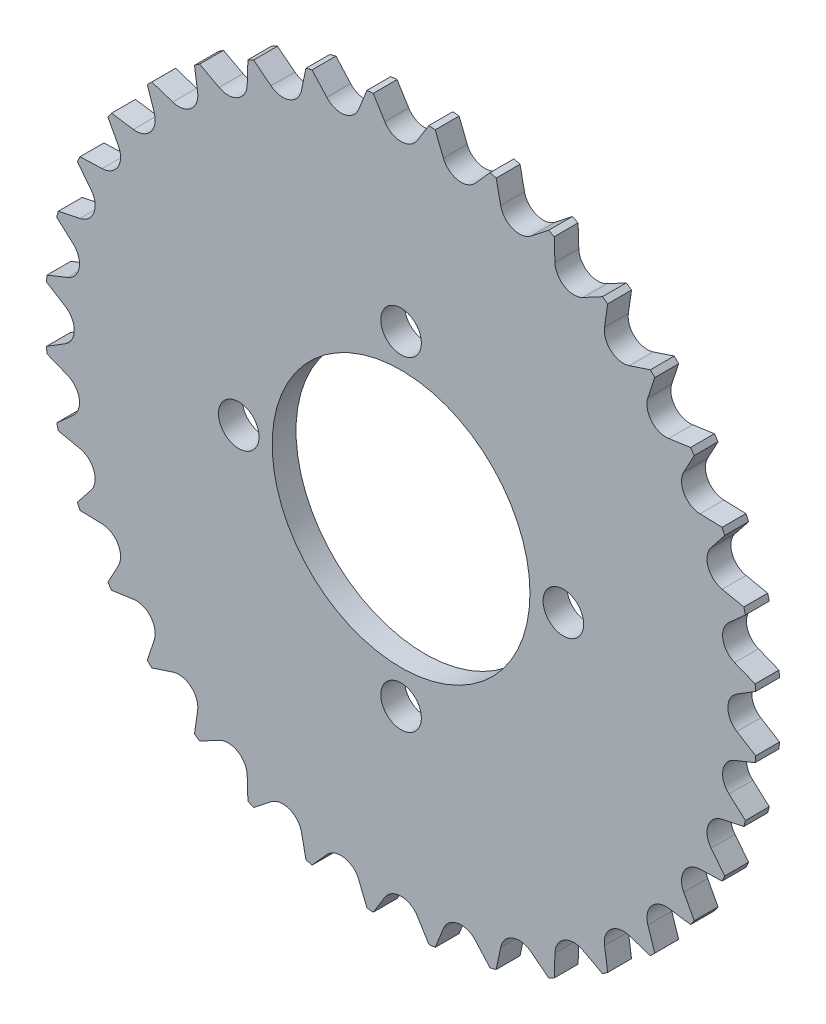
from build123d import *

# Parameters (mm, degrees)
BOSS_EXTRUDE1_DEPTH = 5
SKETCH9_R           = 100
SKETCH9_R_2         = 74.5
CUT_EXTRUDE5_DEPTH  = 10
SKETCH10_R          = 27
SKETCH10_R_2        = 4.25
CUT_EXTRUDE6_DEPTH  = 106.154425696


with BuildPart() as part:
    # Sketch1 → Boss-Extrude1 (new body)
    with BuildSketch(Plane.XY):
        with BuildLine():
            ThreePointArc((3.400646872, 70.34391338), (0, 68.45), (-3.400646872, 70.34391338))
            Line((-3.400646872, 70.34391338), (-6.085453124, 74.679004775))
            ThreePointArc((-6.085453124, 74.679004775), (-6.554111855, 74.913841296), (-6.974871672, 74.601190735))
            Line((-6.974871672, 74.601190735), (-8.866108963, 69.865747406))
            ThreePointArc((-8.866108963, 69.865747406), (-11.886217761, 67.410090694), (-15.564075773, 68.684715142))
            Line((-15.564075773, 68.684715142), (-18.960874506, 72.487735044))
            ThreePointArc((-18.960874506, 72.487735044), (-19.463192192, 72.637622137), (-19.823268522, 72.256657264))
            Line((-19.823268522, 72.256657264), (-20.863472565, 67.264746051))
            ThreePointArc((-20.863472565, 67.264746051), (-23.411278811, 64.321959893), (-27.254598108, 64.93856659))
            Line((-27.254598108, 64.93856659), (-31.260179312, 68.093962165))
            ThreePointArc((-31.260179312, 68.093962165), (-31.780893283, 68.154345585), (-32.069345388, 67.716641827))
            Line((-32.069345388, 67.716641827), (-32.226910109, 62.619939425))
            ThreePointArc((-32.226910109, 62.619939425), (-34.225, 59.279438889), (-38.117003271, 59.219292553))
            Line((-38.117003271, 59.219292553), (-42.609659387, 61.631188702))
            ThreePointArc((-42.609659387, 61.631188702), (-43.132948014, 61.600233731), (-43.341011423, 61.119090493))
            Line((-43.341011423, 61.119090493), (-42.611149298, 56.072457626))
            ThreePointArc((-42.611149298, 56.072457626), (-43.998811883, 52.435742131), (-47.821242577, 51.700670278))
            Line((-47.821242577, 51.700670278), (-52.664466523, 53.295782758))
            ThreePointArc((-52.664466523, 53.295782758), (-53.174429945, 53.174429945), (-53.295782758, 52.664466523))
            Line((-53.295782758, 52.664466523), (-51.700670278, 47.821242577))
            ThreePointArc((-51.700670278, 47.821242577), (-52.435742131, 43.998811883), (-56.072457626, 42.611149298))
            Line((-56.072457626, 42.611149298), (-61.119090493, 43.341011423))
            ThreePointArc((-61.119090493, 43.341011423), (-61.600233731, 43.132948014), (-61.631188702, 42.609659387))
            Line((-61.631188702, 42.609659387), (-59.219292553, 38.117003271))
            ThreePointArc((-59.219292553, 38.117003271), (-59.279438889, 34.225), (-62.619939425, 32.226910109))
            Line((-62.619939425, 32.226910109), (-67.716641827, 32.069345388))
            ThreePointArc((-67.716641827, 32.069345388), (-68.154345585, 31.780893283), (-68.093962165, 31.260179312))
            Line((-68.093962165, 31.260179312), (-64.93856659, 27.254598108))
            ThreePointArc((-64.93856659, 27.254598108), (-64.321959893, 23.411278811), (-67.264746051, 20.863472565))
            Line((-67.264746051, 20.863472565), (-72.256657264, 19.823268522))
            ThreePointArc((-72.256657264, 19.823268522), (-72.637622137, 19.463192192), (-72.487735044, 18.960874506))
            Line((-72.487735044, 18.960874506), (-68.684715142, 15.564075773))
            ThreePointArc((-68.684715142, 15.564075773), (-67.410090694, 11.886217761), (-69.865747406, 8.866108963))
            Line((-69.865747406, 8.866108963), (-74.601190735, 6.974871672))
            ThreePointArc((-74.601190735, 6.974871672), (-74.913841296, 6.554111855), (-74.679004775, 6.085453124))
            Line((-74.679004775, 6.085453124), (-70.34391338, 3.400646872))
            ThreePointArc((-70.34391338, 3.400646872), (-68.45, 0), (-70.34391338, -3.400646872))
            Line((-70.34391338, -3.400646872), (-74.679004775, -6.085453124))
            ThreePointArc((-74.679004775, -6.085453124), (-74.913841296, -6.554111855), (-74.601190735, -6.974871672))
            Line((-74.601190735, -6.974871672), (-69.865747406, -8.866108963))
            ThreePointArc((-69.865747406, -8.866108963), (-67.410090694, -11.886217761), (-68.684715142, -15.564075773))
            Line((-68.684715142, -15.564075773), (-72.487735044, -18.960874506))
            ThreePointArc((-72.487735044, -18.960874506), (-72.637622137, -19.463192192), (-72.256657264, -19.823268522))
            Line((-72.256657264, -19.823268522), (-67.264746051, -20.863472565))
            ThreePointArc((-67.264746051, -20.863472565), (-64.321959893, -23.411278811), (-64.93856659, -27.254598108))
            Line((-64.93856659, -27.254598108), (-68.093962165, -31.260179312))
            ThreePointArc((-68.093962165, -31.260179312), (-68.154345585, -31.780893283), (-67.716641827, -32.069345388))
            Line((-67.716641827, -32.069345388), (-62.619939425, -32.226910109))
            ThreePointArc((-62.619939425, -32.226910109), (-59.279438889, -34.225), (-59.219292553, -38.117003271))
            Line((-59.219292553, -38.117003271), (-61.631188702, -42.609659387))
            ThreePointArc((-61.631188702, -42.609659387), (-61.600233731, -43.132948014), (-61.119090493, -43.341011423))
            Line((-61.119090493, -43.341011423), (-56.072457626, -42.611149298))
            ThreePointArc((-56.072457626, -42.611149298), (-52.435742131, -43.998811883), (-51.700670278, -47.821242577))
            Line((-51.700670278, -47.821242577), (-53.295782758, -52.664466523))
            ThreePointArc((-53.295782758, -52.664466523), (-53.174429945, -53.174429945), (-52.664466523, -53.295782758))
            Line((-52.664466523, -53.295782758), (-47.821242577, -51.700670278))
            ThreePointArc((-47.821242577, -51.700670278), (-43.998811883, -52.435742131), (-42.611149298, -56.072457626))
            Line((-42.611149298, -56.072457626), (-43.341011423, -61.119090493))
            ThreePointArc((-43.341011423, -61.119090493), (-43.132948014, -61.600233731), (-42.609659387, -61.631188702))
            Line((-42.609659387, -61.631188702), (-38.117003271, -59.219292553))
            ThreePointArc((-38.117003271, -59.219292553), (-34.225, -59.279438889), (-32.226910109, -62.619939425))
            Line((-32.226910109, -62.619939425), (-32.069345388, -67.716641827))
            ThreePointArc((-32.069345388, -67.716641827), (-31.780893283, -68.154345585), (-31.260179312, -68.093962165))
            Line((-31.260179312, -68.093962165), (-27.254598108, -64.93856659))
            ThreePointArc((-27.254598108, -64.93856659), (-23.411278811, -64.321959893), (-20.863472565, -67.264746051))
            Line((-20.863472565, -67.264746051), (-19.823268522, -72.256657264))
            ThreePointArc((-19.823268522, -72.256657264), (-19.463192192, -72.637622137), (-18.960874506, -72.487735044))
            Line((-18.960874506, -72.487735044), (-15.564075773, -68.684715142))
            ThreePointArc((-15.564075773, -68.684715142), (-11.886217761, -67.410090694), (-8.866108963, -69.865747406))
            Line((-8.866108963, -69.865747406), (-6.974871672, -74.601190735))
            ThreePointArc((-6.974871672, -74.601190735), (-6.554111855, -74.913841296), (-6.085453124, -74.679004775))
            Line((-6.085453124, -74.679004775), (-3.400646872, -70.34391338))
            ThreePointArc((-3.400646872, -70.34391338), (0, -68.45), (3.400646872, -70.34391338))
            Line((3.400646872, -70.34391338), (6.085453124, -74.679004775))
            ThreePointArc((6.085453124, -74.679004775), (6.554111855, -74.913841296), (6.974871672, -74.601190735))
            Line((6.974871672, -74.601190735), (8.866108963, -69.865747406))
            ThreePointArc((8.866108963, -69.865747406), (11.886217761, -67.410090694), (15.564075773, -68.684715142))
            Line((15.564075773, -68.684715142), (18.960874506, -72.487735044))
            ThreePointArc((18.960874506, -72.487735044), (19.463192192, -72.637622137), (19.823268522, -72.256657264))
            Line((19.823268522, -72.256657264), (20.863472565, -67.264746051))
            ThreePointArc((20.863472565, -67.264746051), (23.411278811, -64.321959893), (27.254598108, -64.93856659))
            Line((27.254598108, -64.93856659), (31.260179312, -68.093962165))
            ThreePointArc((31.260179312, -68.093962165), (31.780893283, -68.154345585), (32.069345388, -67.716641827))
            Line((32.069345388, -67.716641827), (32.226910109, -62.619939425))
            ThreePointArc((32.226910109, -62.619939425), (34.225, -59.279438889), (38.117003271, -59.219292553))
            Line((38.117003271, -59.219292553), (42.609659387, -61.631188702))
            ThreePointArc((42.609659387, -61.631188702), (43.132948014, -61.600233731), (43.341011423, -61.119090493))
            Line((43.341011423, -61.119090493), (42.611149298, -56.072457626))
            ThreePointArc((42.611149298, -56.072457626), (43.998811883, -52.435742131), (47.821242577, -51.700670278))
            Line((47.821242577, -51.700670278), (52.664466523, -53.295782758))
            ThreePointArc((52.664466523, -53.295782758), (53.174429945, -53.174429945), (53.295782758, -52.664466523))
            Line((53.295782758, -52.664466523), (51.700670278, -47.821242577))
            ThreePointArc((51.700670278, -47.821242577), (52.435742131, -43.998811883), (56.072457626, -42.611149298))
            Line((56.072457626, -42.611149298), (61.119090493, -43.341011423))
            ThreePointArc((61.119090493, -43.341011423), (61.600233731, -43.132948014), (61.631188702, -42.609659387))
            Line((61.631188702, -42.609659387), (59.219292553, -38.117003271))
            ThreePointArc((59.219292553, -38.117003271), (59.279438889, -34.225), (62.619939425, -32.226910109))
            Line((62.619939425, -32.226910109), (67.716641827, -32.069345388))
            ThreePointArc((67.716641827, -32.069345388), (68.154345585, -31.780893283), (68.093962165, -31.260179312))
            Line((68.093962165, -31.260179312), (64.93856659, -27.254598108))
            ThreePointArc((64.93856659, -27.254598108), (64.321959893, -23.411278811), (67.264746051, -20.863472565))
            Line((67.264746051, -20.863472565), (72.256657264, -19.823268522))
            ThreePointArc((72.256657264, -19.823268522), (72.637622137, -19.463192192), (72.487735044, -18.960874506))
            Line((72.487735044, -18.960874506), (68.684715142, -15.564075773))
            ThreePointArc((68.684715142, -15.564075773), (67.410090694, -11.886217761), (69.865747406, -8.866108963))
            Line((69.865747406, -8.866108963), (74.601190735, -6.974871672))
            ThreePointArc((74.601190735, -6.974871672), (74.913841296, -6.554111855), (74.679004775, -6.085453124))
            Line((74.679004775, -6.085453124), (70.34391338, -3.400646872))
            ThreePointArc((70.34391338, -3.400646872), (68.45, 0), (70.34391338, 3.400646872))
            Line((70.34391338, 3.400646872), (74.679004775, 6.085453124))
            ThreePointArc((74.679004775, 6.085453124), (74.913841296, 6.554111855), (74.601190735, 6.974871672))
            Line((74.601190735, 6.974871672), (69.865747406, 8.866108963))
            ThreePointArc((69.865747406, 8.866108963), (67.410090694, 11.886217761), (68.684715142, 15.564075773))
            Line((68.684715142, 15.564075773), (72.487735044, 18.960874506))
            ThreePointArc((72.487735044, 18.960874506), (72.637622137, 19.463192192), (72.256657264, 19.823268522))
            Line((72.256657264, 19.823268522), (67.264746051, 20.863472565))
            ThreePointArc((67.264746051, 20.863472565), (64.321959893, 23.411278811), (64.93856659, 27.254598108))
            Line((64.93856659, 27.254598108), (68.093962165, 31.260179312))
            ThreePointArc((68.093962165, 31.260179312), (68.154345585, 31.780893283), (67.716641827, 32.069345388))
            Line((67.716641827, 32.069345388), (62.619939425, 32.226910109))
            ThreePointArc((62.619939425, 32.226910109), (59.279438889, 34.225), (59.219292553, 38.117003271))
            Line((59.219292553, 38.117003271), (61.631188702, 42.609659387))
            ThreePointArc((61.631188702, 42.609659387), (61.600233731, 43.132948014), (61.119090493, 43.341011423))
            Line((61.119090493, 43.341011423), (56.072457626, 42.611149298))
            ThreePointArc((56.072457626, 42.611149298), (52.435742131, 43.998811883), (51.700670278, 47.821242577))
            Line((51.700670278, 47.821242577), (53.295782758, 52.664466523))
            ThreePointArc((53.295782758, 52.664466523), (53.174429945, 53.174429945), (52.664466523, 53.295782758))
            Line((52.664466523, 53.295782758), (47.821242577, 51.700670278))
            ThreePointArc((47.821242577, 51.700670278), (43.998811883, 52.435742131), (42.611149298, 56.072457626))
            Line((42.611149298, 56.072457626), (43.341011423, 61.119090493))
            ThreePointArc((43.341011423, 61.119090493), (43.132948014, 61.600233731), (42.609659387, 61.631188702))
            Line((42.609659387, 61.631188702), (38.117003271, 59.219292553))
            ThreePointArc((38.117003271, 59.219292553), (34.225, 59.279438889), (32.226910109, 62.619939425))
            Line((32.226910109, 62.619939425), (32.069345388, 67.716641827))
            ThreePointArc((32.069345388, 67.716641827), (31.780893283, 68.154345585), (31.260179312, 68.093962165))
            Line((31.260179312, 68.093962165), (27.254598108, 64.93856659))
            ThreePointArc((27.254598108, 64.93856659), (23.411278811, 64.321959893), (20.863472565, 67.264746051))
            Line((20.863472565, 67.264746051), (19.823268522, 72.256657264))
            ThreePointArc((19.823268522, 72.256657264), (19.463192192, 72.637622137), (18.960874506, 72.487735044))
            Line((18.960874506, 72.487735044), (15.564075773, 68.684715142))
            ThreePointArc((15.564075773, 68.684715142), (11.886217761, 67.410090694), (8.866108963, 69.865747406))
            Line((8.866108963, 69.865747406), (6.974871672, 74.601190735))
            ThreePointArc((6.974871672, 74.601190735), (6.554111855, 74.913841296), (6.085453124, 74.679004775))
            Line((6.085453124, 74.679004775), (3.400646872, 70.34391338))
        make_face()
    extrude(amount=BOSS_EXTRUDE1_DEPTH)

    # Sketch9 → Cut-Extrude5 (cut)
    with BuildSketch(Plane(origin=(0, 0, 0), x_dir=(-1, 0, 0), z_dir=(0, 0, -1))):
        Circle(SKETCH9_R)
        Circle(SKETCH9_R_2, mode=Mode.SUBTRACT)
    extrude(amount=-CUT_EXTRUDE5_DEPTH, mode=Mode.SUBTRACT)

    # Sketch10 → Cut-Extrude6 (cut, through all)
    with BuildSketch(Plane.XY.offset(5)):
        Circle(SKETCH10_R)
        with Locations((0, 34)):
            Circle(SKETCH10_R_2)
        with Locations((34, 0)):
            Circle(SKETCH10_R_2)
        with Locations((0, -34)):
            Circle(SKETCH10_R_2)
        with Locations((-34, 0)):
            Circle(SKETCH10_R_2)
    extrude(amount=-CUT_EXTRUDE6_DEPTH, mode=Mode.SUBTRACT)


solid = part.part
